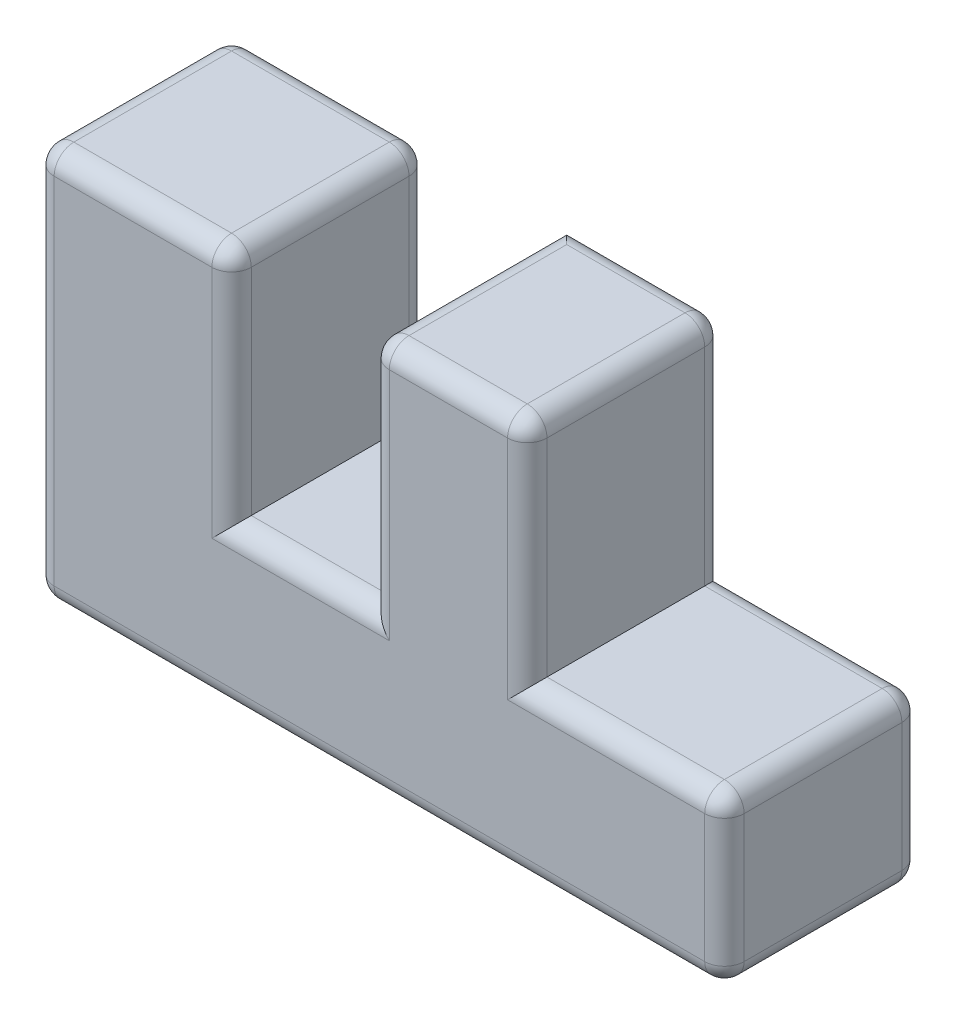
from build123d import *

# Parameters (mm, degrees)
BOSS_EXTRUDE2_DEPTH = 25.4
FILLET4_R           = 2.54
FILLET5_R           = 2.54
FILLET6_R           = 2.54


with BuildPart() as part:
    # Sketch1 → Boss-Extrude2 (new body)
    with BuildSketch(Plane.XY):
        Polygon((0, 0), (0, 50.8), (25.4, 50.8), (25.4, 20.561904762), (43.18, 20.561904762), (43.18, 50.8), (63.5, 50.8), (63.5, 21.59), (88.9, 21.59), (88.9, 0), align=None)
    extrude(amount=BOSS_EXTRUDE2_DEPTH)

    # Fillet4
    fillet4_edges = [part.edges().sort_by_distance(p)[0] for p in [
        (12.7, 50.8, 25.4),
    ]]
    fillet(fillet4_edges, radius=FILLET4_R)

    # Fillet5
    fillet5_edges = [part.edges().sort_by_distance(p)[0] for p in [
        (12.7, 50.8, 0),
        (25.4, 35.680952381, 0),
        (34.29, 20.561904762, 0),
        (53.34, 50.8, 0),
        (63.5, 36.195, 0),
        (76.2, 21.59, 25.4),
        (76.2, 21.59, 0),
        (63.5, 36.195, 25.4),
        (43.18, 50.8, 12.7),
        (63.5, 50.8, 12.7),
        (88.9, 21.59, 12.7),
        (53.34, 50.8, 25.4),
        (43.18, 35.680952381, 25.4),
        (34.29, 20.561904762, 25.4),
        (0, 24.13, 25.4),
        (0, 50.8, 11.43),
        (0, 50.056051224, 24.656051224),
        (25.4, 50.8, 11.43),
        (25.4, 50.056051224, 24.656051224),
        (25.4, 34.410952381, 25.4),
    ]]
    fillet(fillet5_edges, radius=FILLET5_R)

    # Fillet6
    # the kernel refuses this fillet: 2.54 mm, written as the material it takes off along each edge
    with BuildSketch(Plane(origin=(86.36, 19.05, 2.54), x_dir=(0, 0, -1), z_dir=(1, 0, 0))) as fillet6_piece_1_section:
        Polygon((0, 0), (FILLET6_R, 0), (FILLET6_R, FILLET6_R), (0, FILLET6_R), align=None)
    fillet6_piece_1 = extrude(amount=FILLET6_R, mode=Mode.PRIVATE)
    fillet6_piece_1 = fillet6_piece_1 - Plane(origin=(86.36, 19.05, 2.54), x_dir=(0, -0.7071067811865475, 0.7071067811865475), z_dir=(1, 0, 0)) * Sphere(FILLET6_R, mode=Mode.PRIVATE)
    add(fillet6_piece_1, mode=Mode.SUBTRACT)
    with BuildSketch(Plane(origin=(86.36, 19.05, 22.86), x_dir=(0, 0, 1), z_dir=(1, 0, 0))) as fillet6_piece_2_section:
        Polygon((0, 0), (FILLET6_R, 0), (FILLET6_R, -FILLET6_R), (0, -FILLET6_R), align=None)
    fillet6_piece_2 = extrude(amount=FILLET6_R, mode=Mode.PRIVATE)
    fillet6_piece_2 = fillet6_piece_2 - Plane(origin=(86.36, 19.05, 22.86), x_dir=(0, -0.7071067811865475, -0.7071067811865475), z_dir=(1, 0, 0)) * Sphere(FILLET6_R, mode=Mode.PRIVATE)
    add(fillet6_piece_2, mode=Mode.SUBTRACT)
    with BuildSketch(Plane(origin=(2.54, 48.26, 2.54), x_dir=(0, 0, -1), z_dir=(-1, 0, 0))) as fillet6_piece_3_section:
        Polygon((0, 0), (FILLET6_R, 0), (FILLET6_R, -FILLET6_R), (0, -FILLET6_R), align=None)
    fillet6_piece_3 = extrude(amount=FILLET6_R, mode=Mode.PRIVATE)
    fillet6_piece_3 = fillet6_piece_3 - Plane(origin=(2.54, 48.26, 2.54), x_dir=(0, -0.7071067811865475, 0.7071067811865475), z_dir=(-1, 0, 0)) * Sphere(FILLET6_R, mode=Mode.PRIVATE)
    add(fillet6_piece_3, mode=Mode.SUBTRACT)
    with BuildSketch(Plane(origin=(86.36, 2.54, 2.54), x_dir=(0, -1, 0), z_dir=(1, 0, 0))) as fillet6_piece_4_section:
        Polygon((0, 0), (FILLET6_R, 0), (FILLET6_R, FILLET6_R), (0, FILLET6_R), align=None)
    fillet6_piece_4 = extrude(amount=FILLET6_R, mode=Mode.PRIVATE)
    fillet6_piece_4 = fillet6_piece_4 - Plane(origin=(86.36, 2.54, 2.54), x_dir=(0, 0.7071067811865475, 0.7071067811865475), z_dir=(1, 0, 0)) * Sphere(FILLET6_R, mode=Mode.PRIVATE)
    add(fillet6_piece_4, mode=Mode.SUBTRACT)
    with BuildSketch(Plane(origin=(2.54, 2.54, 2.54), x_dir=(0, -1, 0), z_dir=(-1, 0, 0))) as fillet6_piece_5_section:
        Polygon((0, 0), (FILLET6_R, 0), (FILLET6_R, -FILLET6_R), (0, -FILLET6_R), align=None)
    fillet6_piece_5 = extrude(amount=FILLET6_R, mode=Mode.PRIVATE)
    fillet6_piece_5 = fillet6_piece_5 - Plane(origin=(2.54, 2.54, 2.54), x_dir=(0, 0.7071067811865475, 0.7071067811865475), z_dir=(-1, 0, 0)) * Sphere(FILLET6_R, mode=Mode.PRIVATE)
    add(fillet6_piece_5, mode=Mode.SUBTRACT)
    with BuildSketch(Plane(origin=(86.36, 2.54, 22.86), x_dir=(0, 0, 1), z_dir=(1, 0, 0))) as fillet6_piece_6_section:
        Polygon((0, 0), (FILLET6_R, 0), (FILLET6_R, FILLET6_R), (0, FILLET6_R), align=None)
    fillet6_piece_6 = extrude(amount=FILLET6_R, mode=Mode.PRIVATE)
    fillet6_piece_6 = fillet6_piece_6 - Plane(origin=(86.36, 2.54, 22.86), x_dir=(0, 0.7071067811865475, -0.7071067811865475), z_dir=(1, 0, 0)) * Sphere(FILLET6_R, mode=Mode.PRIVATE)
    add(fillet6_piece_6, mode=Mode.SUBTRACT)
    with BuildSketch(Plane(origin=(88.9, 19.05, 0), x_dir=(0, 0, 1), z_dir=(0, -1, 0))) as fillet6_piece_7:
        with BuildLine():
            CenterArc((FILLET6_R, FILLET6_R), FILLET6_R, 180, 90)
            Line((0, FILLET6_R), (0, 0))
            Line((0, 0), (FILLET6_R, 0))
        make_face()
    extrude(amount=16.51, mode=Mode.SUBTRACT)
    with BuildSketch(Plane(origin=(86.36, 0, 0), x_dir=(0, 0, 1), z_dir=(-1, 0, 0)), Plane(origin=(86.36, 0, 25.4), x_dir=(0, 1, 0), z_dir=(-1, 0, 0))) as fillet6_piece_8:
        with BuildLine():
            CenterArc((FILLET6_R, FILLET6_R), FILLET6_R, 180, 90)
            Line((0, FILLET6_R), (0, 0))
            Line((0, 0), (FILLET6_R, 0))
        make_face()
    extrude(amount=83.82, mode=Mode.SUBTRACT)
    with BuildSketch(Plane(origin=(88.9, 0, 2.54), x_dir=(0, 1, 0), z_dir=(0, 0, 1))) as fillet6_piece_9:
        with BuildLine():
            CenterArc((FILLET6_R, FILLET6_R), FILLET6_R, 180, 90)
            Line((0, FILLET6_R), (0, 0))
            Line((0, 0), (FILLET6_R, 0))
        make_face()
    extrude(amount=20.32, mode=Mode.SUBTRACT)
    with BuildSketch(Plane(origin=(0, 0, 2.54), x_dir=(0, 1, 0), z_dir=(0, 0, 1))) as fillet6_piece_10:
        with BuildLine():
            CenterArc((FILLET6_R, -FILLET6_R), FILLET6_R, 90, 90)
            Line((0, -FILLET6_R), (0, 0))
            Line((0, 0), (FILLET6_R, 0))
        make_face()
    extrude(amount=20.32, mode=Mode.SUBTRACT)
    with BuildSketch(Plane(origin=(2.54, 0, 22.86), x_dir=(-1, 0, 0), z_dir=(0, 0, -1))) as fillet6_piece_11:
        with BuildLine():
            CenterArc((2.54 - FILLET6_R, FILLET6_R), FILLET6_R, 270, 90)
            Line((2.54 - FILLET6_R, 0), (2.54, 0))
            Line((2.54, 0), (2.54, FILLET6_R))
        make_face()
    revolve(axis=Axis((2.54, 0, 22.86), (0, 1, 0)), revolution_arc=90, mode=Mode.SUBTRACT)
    with BuildSketch(Plane(origin=(0, 2.54, 0), x_dir=(0, 0, 1), z_dir=(0, 1, 0))) as fillet6_piece_12:
        with BuildLine():
            CenterArc((FILLET6_R, FILLET6_R), FILLET6_R, 180, 90)
            Line((0, FILLET6_R), (0, 0))
            Line((0, 0), (FILLET6_R, 0))
        make_face()
    extrude(amount=45.72, mode=Mode.SUBTRACT)
    with BuildSketch(Plane(origin=(88.9, 19.05, 25.4), x_dir=(0, 0, -1), z_dir=(0, -1, 0))) as fillet6_piece_13:
        with BuildLine():
            CenterArc((FILLET6_R, -FILLET6_R), FILLET6_R, 90, 90)
            Line((0, -FILLET6_R), (0, 0))
            Line((0, 0), (FILLET6_R, 0))
        make_face()
    extrude(amount=16.51, mode=Mode.SUBTRACT)


solid = part.part
